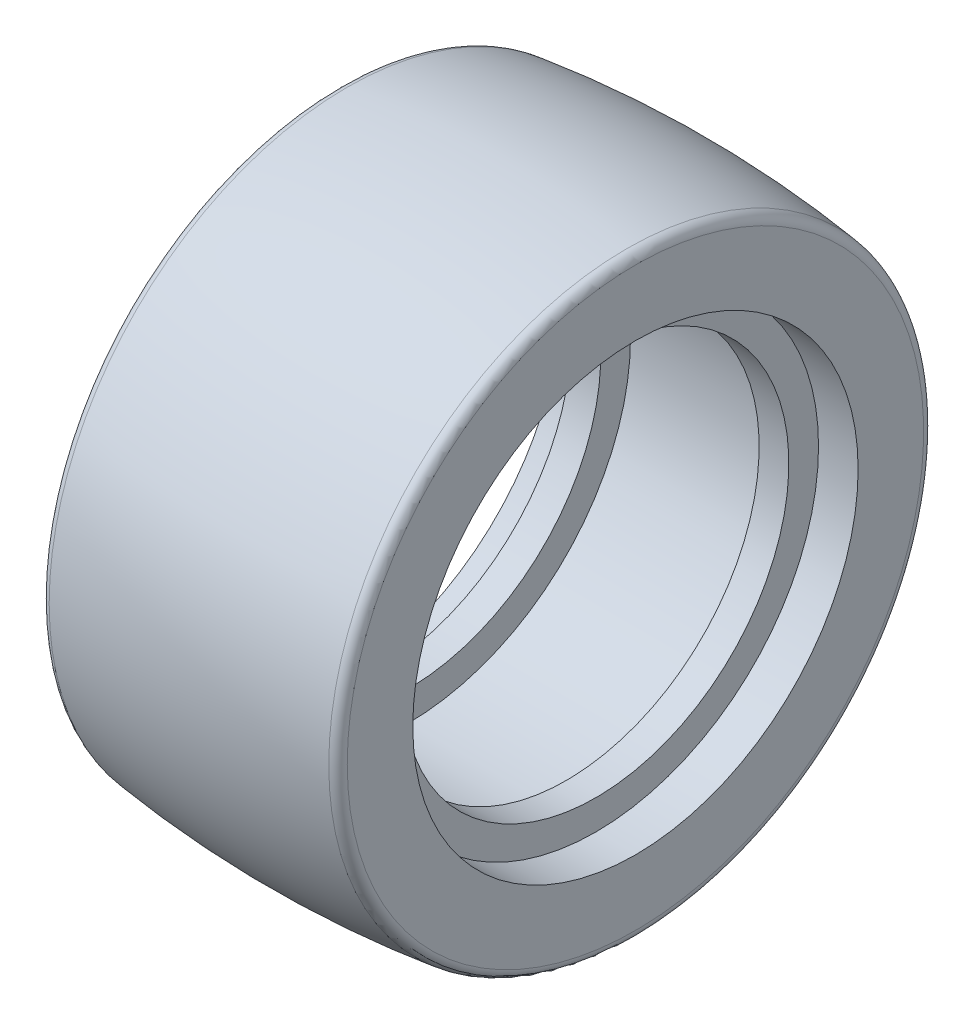
from build123d import *

# Parameters (mm, degrees)
FILLET_1_R = 1


with BuildPart() as part:
    # Эскиз1 → Повернуть1 (revolve)
    with BuildSketch(Plane.XY):
        with BuildLine():
            Line((-15, 30), (-15, 22.5))
            Line((-15, 22.5), (-11, 22.5))
            Line((-11, 22.5), (-11, 19.5))
            Line((-11, 19.5), (-8, 19.5))
            Line((-8, 19.5), (-8, 22.5))
            Line((-8, 22.5), (8, 22.5))
            Line((8, 22.5), (8, 19.5))
            Line((8, 19.5), (11, 19.5))
            Line((11, 19.5), (11, 22.5))
            Line((11, 22.5), (15, 22.5))
            Line((15, 22.5), (15, 30))
            ThreePointArc((15, 30), (0, 31), (-15, 30))
        make_face()
    revolve(axis=Axis((-27.729022135, 0, 0), (1, 0, 0)))

    # Скругление1
    fillet_1_edges = [part.edges().sort_by_distance(p)[0] for p in [
        (15, -30, 0),
        (-15, -30, 0),
    ]]
    fillet(fillet_1_edges, radius=FILLET_1_R)


solid = part.part
